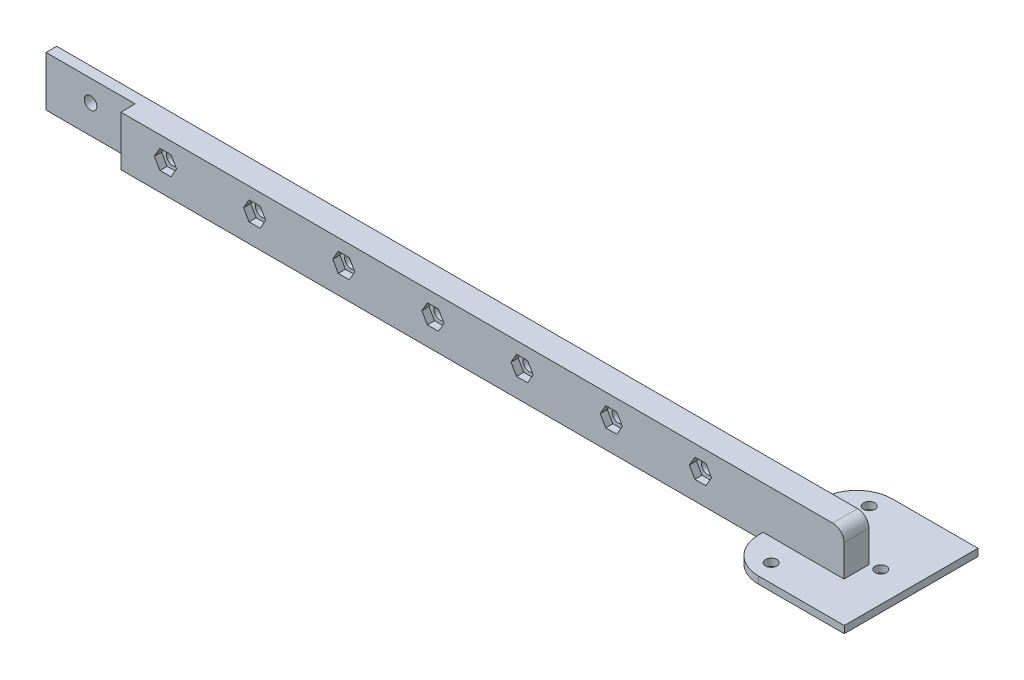
from build123d import *

# Parameters (mm, degrees)
TOPSKETCH1_R                        = 1.59
TOPBOSS_EXTRUDE1_DEPTH              = 2
FILLET1_R                           = 10
LINEARRAILHEIGHTSKETCH2_W           = 227.746666667
LINEARRAILHEIGHTSKETCH2_H           = 7
LINEARRAILHEIGHTBOSS_EXTRUDE2_DEPTH = 12
LINEARRAILHOLESSKETCH3_R            = 1.75
LINEARRAILHOLESCUT_EXTRUDE1_DEPTH   = 208.226612432
CONNECTINGPLATESKETCH1_W            = 25
CONNECTINGPLATESKETCH1_H            = 14
CONNECTINGPLATECUT_EXTRUDE1_DEPTH   = 4
FILLET2_R                           = 3.175
NUTHOLESKETCJCUT_EXTRUDE1_DEPTH     = 2


with BuildPart() as part:
    # TopSketch1 → TopBoss-Extrude1 (new body)
    with BuildSketch(Plane(origin=(0, 0, 0), x_dir=(1, 0, 0), z_dir=(0, 1, 0))):
        Polygon((0, 0), (34, 0), (34, 37.5), (0, 37.5), (0, 19.25), (-205.08, 19.25), (-205.08, 11.25), (0, 11.25), align=None)
        with Locations((8.5, 32.5)):
            Circle(TOPSKETCH1_R, mode=Mode.SUBTRACT)
        with Locations((8.5, 5)):
            Circle(TOPSKETCH1_R, mode=Mode.SUBTRACT)
        with Locations((25.5, 18.75)):
            Circle(TOPSKETCH1_R, mode=Mode.SUBTRACT)
    extrude(amount=TOPBOSS_EXTRUDE1_DEPTH)

    # Fillet1
    fillet1_edges = [part.edges().sort_by_distance(p)[0] for p in [
        (0, 1, 0),
        (0, 1, -37.5),
    ]]
    fillet(fillet1_edges, radius=FILLET1_R)

    # LinearRailHEightSketch2 → LinearRailHeightBoss-Extrude2 (add)
    with BuildSketch(Plane(origin=(0, 2, 0), x_dir=(1, 0, 0), z_dir=(0, 1, 0))):
        with Locations((-91.206666667, 14.75)):
            Rectangle(LINEARRAILHEIGHTSKETCH2_W, LINEARRAILHEIGHTSKETCH2_H)
    extrude(amount=LINEARRAILHEIGHTBOSS_EXTRUDE2_DEPTH)

    # LinearRailHolesSketch3 → LinearRailHolesCut-Extrude1 (cut, through all)
    with BuildSketch(Plane.XY.offset(-11.25)):
        with Locations((-192.58, 8)):
            Circle(LINEARRAILHOLESSKETCH3_R)
        with Locations((-167.58, 8)):
            Circle(LINEARRAILHOLESSKETCH3_R)
        with Locations((-142.58, 8)):
            Circle(LINEARRAILHOLESSKETCH3_R)
        with Locations((-117.58, 8)):
            Circle(LINEARRAILHOLESSKETCH3_R)
        with Locations((-92.58, 8)):
            Circle(LINEARRAILHOLESSKETCH3_R)
        with Locations((-67.58, 8)):
            Circle(LINEARRAILHOLESSKETCH3_R)
        with Locations((-42.58, 8)):
            Circle(LINEARRAILHOLESSKETCH3_R)
        with Locations((-17.58, 8)):
            Circle(LINEARRAILHOLESSKETCH3_R)
    extrude(amount=-LINEARRAILHOLESCUT_EXTRUDE1_DEPTH, mode=Mode.SUBTRACT)

    # ConnectingPlateSketch1 → ConnectingPlateCut-Extrude1 (cut)
    with BuildSketch(Plane.XY.offset(-11.25)):
        with Locations((-192.58, 7)):
            Rectangle(CONNECTINGPLATESKETCH1_W, CONNECTINGPLATESKETCH1_H)
    extrude(amount=-CONNECTINGPLATECUT_EXTRUDE1_DEPTH, mode=Mode.SUBTRACT)

    # Fillet2
    fillet2_edges = [part.edges().sort_by_distance(p)[0] for p in [
        (22.666666667, 14, -14.75),
    ]]
    fillet(fillet2_edges, radius=FILLET2_R)

    # NutHoleSketch1 → NutHoleSketcjCut-Extrude1 (cut)
    with BuildSketch(Plane.XY.offset(-11.25)):
        Polygon((-166.03, 5.315321248), (-164.48, 8), (-166.03, 10.684678752), (-169.13, 10.684678752), (-170.68, 8), (-169.13, 5.315321248), align=None)
        Polygon((-141.03, 5.315321248), (-139.48, 8), (-141.03, 10.684678752), (-144.13, 10.684678752), (-145.68, 8), (-144.13, 5.315321248), align=None)
        Polygon((-116.03, 5.315321248), (-114.48, 8), (-116.03, 10.684678752), (-119.13, 10.684678752), (-120.68, 8), (-119.13, 5.315321248), align=None)
        Polygon((-91.03, 5.315321248), (-89.48, 8), (-91.03, 10.684678752), (-94.13, 10.684678752), (-95.68, 8), (-94.13, 5.315321248), align=None)
        Polygon((-66.03, 5.315321248), (-64.48, 8), (-66.03, 10.684678752), (-69.13, 10.684678752), (-70.68, 8), (-69.13, 5.315321248), align=None)
        Polygon((-41.03, 5.315321248), (-39.48, 8), (-41.03, 10.684678752), (-44.13, 10.684678752), (-45.68, 8), (-44.13, 5.315321248), align=None)
        Polygon((-16.03, 5.315321248), (-14.48, 8), (-16.03, 10.684678752), (-19.13, 10.684678752), (-20.68, 8), (-19.13, 5.315321248), align=None)
    extrude(amount=-NUTHOLESKETCJCUT_EXTRUDE1_DEPTH, mode=Mode.SUBTRACT)


solid = part.part
